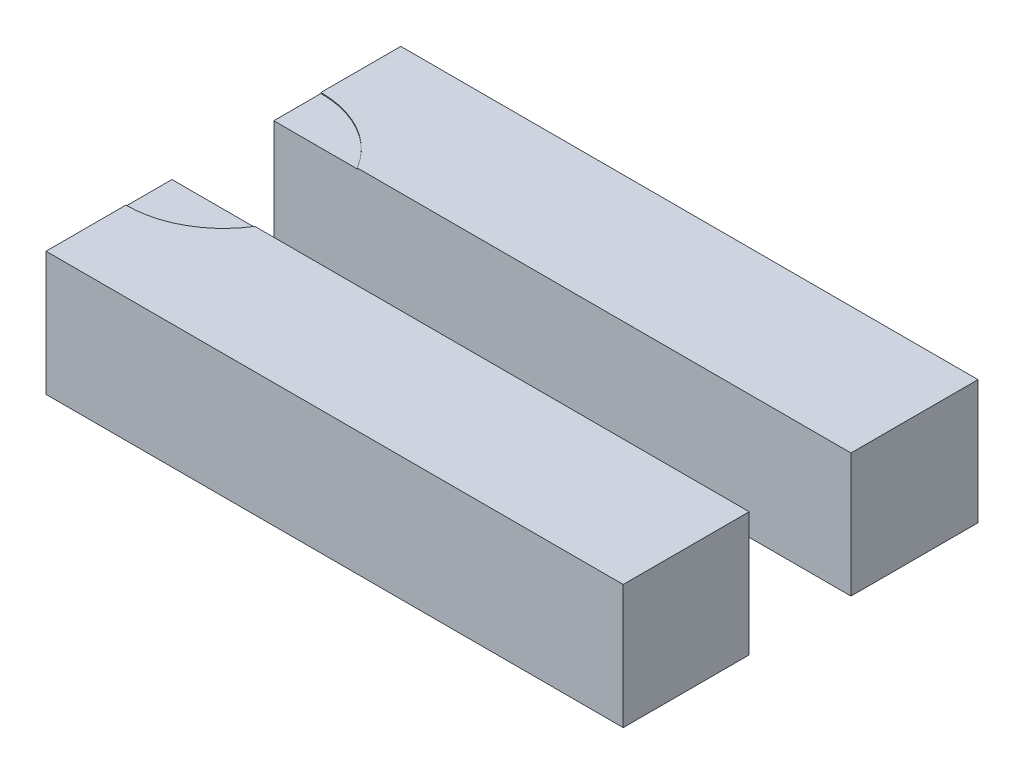
from build123d import *

# Parameters (mm, degrees)
SKETCH1_W                   = 82.6516
SKETCH1_H                   = 25.4
BOSS_EXTRUDE1_DEPTH         = 9.5758
SKETCH2_W                   = 50.8
SKETCH2_H                   = 7.2898
CUT_EXTRUDE1_DEPTH          = 45.281008246
SKETCH8_W                   = 2.902818519
SKETCH8_H                   = 9.580147983
BOSS_EXTRUDE4_DEPTH         = 25.4
SKETCH10_R                  = 12.7
BOSS_EXTRUDE5_DEPTH         = 50.1015
SKETCH12_R                  = 6.985
CUT_EXTRUDE2_DEPTH          = 50.8635
CHAMFER1_SIZE               = 2.54
SKETCH14_W                  = 12.7
SKETCH14_H                  = 25.4
BOSS_EXTRUDE6_DEPTH         = 15.24
CUT_EXTRUDE3_REACH          = 81.551
SKETCH18_W                  = 5.842
SKETCH18_H                  = 11.43
F_1_4_CLEARANCE_HOLE2_D     = 6.7564
F_1_4_CLEARANCE_HOLE2_DEPTH = 20.32
F_1_4_CLEARANCE_HOLE2_TIP   = 2.029827343
CHAMFER2_SIZE               = 10.16
SKETCH21_W                  = 102.171089711
SKETCH21_H                  = 59.0255269
CUT_EXTRUDE4_DEPTH          = 50.8
SKETCH22_W                  = 33.761950456
SKETCH22_H                  = 15.29053624
CUT_EXTRUDE5_DEPTH          = 45.135226304


with BuildPart() as part:
    # Sketch1 → Boss-Extrude1 (new body)
    with BuildSketch(Plane(origin=(0, 0, 0), x_dir=(1, 0, 0), z_dir=(0, 1, 0))):
        Rectangle(SKETCH1_W, SKETCH1_H)
    extrude(amount=BOSS_EXTRUDE1_DEPTH)

    # Sketch2 → Cut-Extrude1 (cut, through all)
    with BuildSketch(Plane(origin=(0, 9.5758, 0), x_dir=(1, 0, 0), z_dir=(0, 1, 0))):
        with Locations((15.9258, -0.0381)):
            Rectangle(SKETCH2_W, SKETCH2_H)
    extrude(amount=-CUT_EXTRUDE1_DEPTH, mode=Mode.SUBTRACT)

    # Sketch8 → Boss-Extrude4 (add, through all)
    with BuildSketch(Plane.XY.offset(12.7)):
        with Locations((-1.45140926, 4.790073991)):
            Rectangle(SKETCH8_W, SKETCH8_H)
    extrude(amount=-BOSS_EXTRUDE4_DEPTH)

    # Sketch10 → Boss-Extrude5 (add)
    with BuildSketch(Plane(origin=(0, 9.5758, 0), x_dir=(1, 0, 0), z_dir=(0, 1, 0))):
        with Locations(Location((0, 0, 0), (0, 0, 270))):
            Circle(SKETCH10_R)
    extrude(amount=BOSS_EXTRUDE5_DEPTH)

    # Sketch12 → Cut-Extrude2 (cut)
    with BuildSketch(Plane(origin=(0, 59.6773, 0), x_dir=(1, 0, 0), z_dir=(0, 1, 0))):
        with Locations(Location((0, 0, 0), (0, 0, 270))):
            Circle(SKETCH12_R)
    extrude(amount=-CUT_EXTRUDE2_DEPTH, mode=Mode.SUBTRACT)

    # Chamfer1
    chamfer1_edges = [part.edges().sort_by_distance(p)[0] for p in [
        (0, 59.6773, -12.7),
    ]]
    chamfer(chamfer1_edges, length=CHAMFER1_SIZE)

    # Sketch14 → Boss-Extrude6 (add)
    with BuildSketch(Plane.XY.offset(-6.985)):
        with Locations((0, 41.790845474)):
            Rectangle(SKETCH14_W, SKETCH14_H)
    extrude(amount=-BOSS_EXTRUDE6_DEPTH)

    # Sketch18 → Cut-Extrude3 (cut, up to next)
    with BuildSketch(Plane(origin=(6.35, 0, 0), x_dir=(0, 0, -1), z_dir=(1, 0, 0)), mode=Mode.PRIVATE) as cut_extrude3_sk1:
        with Locations((16.149395763, 44.965845474)):
            Rectangle(SKETCH18_W, SKETCH18_H)
    cut_extrude3_tool1 = extrude(cut_extrude3_sk1.sketch, amount=-CUT_EXTRUDE3_REACH, mode=Mode.PRIVATE) & part.part
    add(cut_extrude3_tool1.solids().sort_by_distance((6.35, 44.965845, -16.149396))[0], mode=Mode.SUBTRACT)

    # 1/4 Clearance Hole2
    with Locations(Plane(origin=(0, 0, -22.225), x_dir=(-1, 0, 0), z_dir=(0, 0, -1))):
        with Locations((0, 44.965845474)):
            Hole(F_1_4_CLEARANCE_HOLE2_D / 2, depth=F_1_4_CLEARANCE_HOLE2_DEPTH)
            with Locations((0, 0, -(F_1_4_CLEARANCE_HOLE2_DEPTH + F_1_4_CLEARANCE_HOLE2_TIP / 2))):  # 118° drill point
                Cone(0, F_1_4_CLEARANCE_HOLE2_D / 2, F_1_4_CLEARANCE_HOLE2_TIP, mode=Mode.SUBTRACT)

    # Chamfer2
    # the kernel refuses this chamfer: 10.16 mm, written as the material it takes off along each edge
    with BuildSketch(Plane(origin=(32.478299158, 29.090845474, -22.225), x_dir=(0, -0.027495876610586265, 0.9996219169112968), z_dir=(-1, 0, 0))) as chamfer2_piece_1_section:
        Polygon((CHAMFER2_SIZE * 0.999621916911, CHAMFER2_SIZE * 0.0274958766106), (-CHAMFER2_SIZE * 0.0274958766106, CHAMFER2_SIZE * 0.999621916911), (0, 0), align=None)
    chamfer2_piece_1 = extrude(amount=64.956598315, mode=Mode.PRIVATE)
    chamfer2_piece_1 = chamfer2_piece_1 - Plane(origin=(0, 32.444576681, 0), x_dir=(0, 0, 1), z_dir=(0, -1, 0)) * Cylinder(12.7, 171, mode=Mode.PRIVATE)
    add(chamfer2_piece_1, mode=Mode.SUBTRACT)

    # Sketch21 → Cut-Extrude4 (cut)
    with BuildSketch(Plane(origin=(0, 59.6773, 0), x_dir=(1, 0, 0), z_dir=(0, 1, 0))):
        with Locations((-1.148550861, 3.01470521)):
            Rectangle(SKETCH21_W, SKETCH21_H)
    extrude(amount=-CUT_EXTRUDE4_DEPTH, mode=Mode.SUBTRACT)

    # Sketch22 → Cut-Extrude5 (cut, through all)
    with BuildSketch(Plane(origin=(0, 0, 0), x_dir=(0, 0, -1), z_dir=(1, 0, 0))):
        with Locations((-0.418536576, 4.020113424)):
            Rectangle(SKETCH22_W, SKETCH22_H)
    extrude(amount=-CUT_EXTRUDE5_DEPTH, mode=Mode.SUBTRACT)


with BuildPart() as cut_extrude5_piece_1:
    # of the separate pieces the step leaves, piece 1, a body of its own (cut_extrude5_pieces)
    add(part.part.solids().sort_by_distance((0, 0, -12.7))[0])


with BuildPart() as cut_extrude5_piece_2:
    # of the separate pieces the step leaves, piece 2, a body of its own (cut_extrude5_pieces)
    add(part.part.solids().sort_by_distance((5.935127294, 8.8773, 3.683))[0])


solid = Compound([cut_extrude5_piece_1.part, cut_extrude5_piece_2.part])
